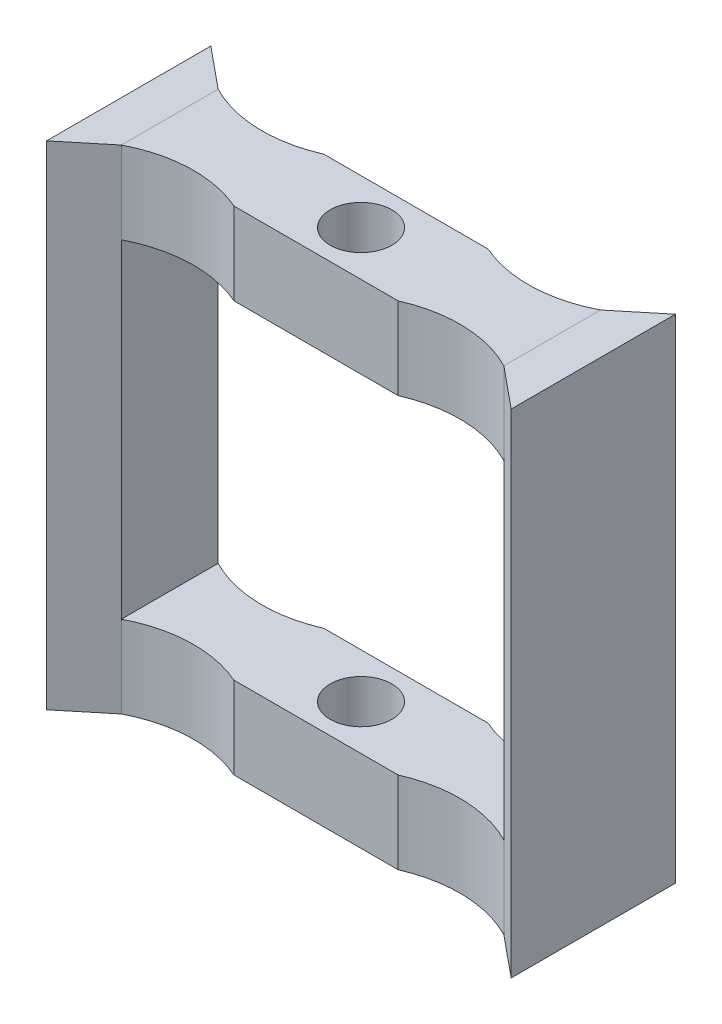
from build123d import *

# Parameters (mm, degrees)
BOSS_EXTRUDE1_DEPTH   = 38.1
BOSS_EXTRUDE1_2_DEPTH = 38.1
SKETCH5_R             = 4.7625
BOSS_EXTRUDE2_DEPTH   = 12.7


with BuildPart() as part:
    # Sketch4 → Boss-Extrude1 (new, symmetric)
    with BuildSketch(Plane(origin=(0, 0, 0), x_dir=(1, 0, 0), z_dir=(0, 1, 0))):
        Polygon((29.571024484, -7.476459925), (35.921024484, -12.7), (35.921024484, 12.7), (29.571024484, 7.476459925), align=None)
    extrude(amount=BOSS_EXTRUDE1_DEPTH, both=True)


with BuildPart() as body_2:
    # Sketch4 → Boss-Extrude1 2 (new, symmetric)
    with BuildSketch(Plane(origin=(0, 0, 0), x_dir=(1, 0, 0), z_dir=(0, 1, 0))):
        Polygon((-35.921024484, 12.7), (-29.571024484, 7.476459925), (-29.571024484, -7.476459925), (-35.921024484, -12.7), align=None)
    extrude(amount=BOSS_EXTRUDE1_2_DEPTH, both=True)


with BuildPart() as body_3:
    # Sketch5 → Boss-Extrude2 (new body)
    with BuildSketch(Plane(origin=(0, 38.1, 0), x_dir=(1, 0, 0), z_dir=(0, 1, 0))):
        with BuildLine():
            Line((-29.571024484, 7.476459925), (-29.571024484, -7.476459925))
            ThreePointArc((-29.571024484, -7.476459925), (-21.195588341, -5.300623646), (-12.7, -6.945972494))
            Line((-12.7, -6.945972494), (12.7, -6.945972494))
            ThreePointArc((12.7, -6.945972494), (21.195588341, -5.300623646), (29.571024484, -7.476459925))
            Line((29.571024484, -7.476459925), (29.571024484, 7.476459925))
            ThreePointArc((29.571024484, 7.476459925), (21.195588341, 5.300623646), (12.7, 6.945972494))
            Line((12.7, 6.945972494), (-12.7, 6.945972494))
            ThreePointArc((-12.7, 6.945972494), (-21.195588341, 5.300623646), (-29.571024484, 7.476459925))
        make_face()
        Circle(SKETCH5_R, mode=Mode.SUBTRACT)
    extrude(amount=-BOSS_EXTRUDE2_DEPTH)


with BuildPart() as body_4:
    # Mirror2: mirrored copy
    add(body_3.part.mirror(Plane.ZX))


solid = Compound([part.part, body_2.part, body_3.part, body_4.part])
